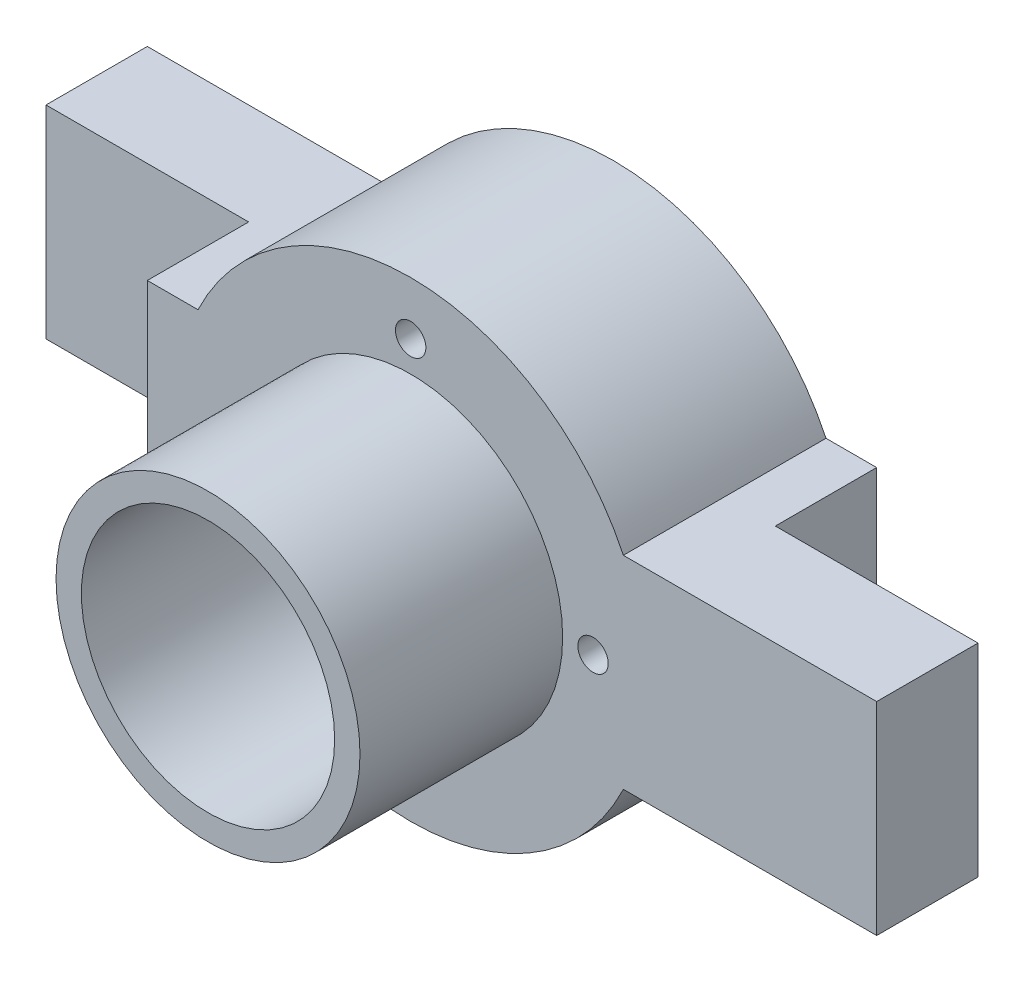
from build123d import *

# Parameters (mm, degrees)
CROQUIS1_R              = 15
CROQUIS1_R_2            = 12.5
SALIENTE_EXTRUIR1_DEPTH = 20
CROQUIS8_R              = 23.25
CROQUIS8_R_2            = 1.5
SALIENTE_EXTRUIR2_DEPTH = 20
CROQUIS10_W             = 25
CROQUIS10_H             = 20
SALIENTE_EXTRUIR6_DEPTH = 20
CROQUIS11_W             = 20
CROQUIS11_H             = 20
CORTAR_EXTRUIR2_DEPTH   = 10
CROQUIS12_W             = 20
CROQUIS12_H             = 20
CORTAR_EXTRUIR3_DEPTH   = 10


with BuildPart() as part:
    # Croquis1 → Saliente-Extruir1 (new body)
    with BuildSketch(Plane.XY):
        Circle(CROQUIS1_R)
        Circle(CROQUIS1_R_2, mode=Mode.SUBTRACT)
    extrude(amount=-SALIENTE_EXTRUIR1_DEPTH)

    # Croquis8 → Saliente-Extruir2 (add)
    with BuildSketch(Plane(origin=(0, 0, -20), x_dir=(-1, 0, 0), z_dir=(0, 0, -1))):
        Circle(CROQUIS8_R)
        with Locations((0, 18)):
            Circle(CROQUIS8_R_2, mode=Mode.SUBTRACT)
        with Locations((18, 0)):
            Circle(CROQUIS8_R_2, mode=Mode.SUBTRACT)
        with Locations((0, -18)):
            Circle(CROQUIS8_R_2, mode=Mode.SUBTRACT)
        with Locations((-18, 0)):
            Circle(CROQUIS8_R_2, mode=Mode.SUBTRACT)
    extrude(amount=SALIENTE_EXTRUIR2_DEPTH)

    # Croquis10 → Saliente-Extruir6 (add)
    with BuildSketch(Plane(origin=(0, 0, -40), x_dir=(-1, 0, 0), z_dir=(0, 0, -1))):
        with Locations((-33.489580749, 0)):
            Rectangle(CROQUIS10_W, CROQUIS10_H)
        with Locations((33.489580749, 0)):
            Rectangle(CROQUIS10_W, CROQUIS10_H)
    extrude(amount=-SALIENTE_EXTRUIR6_DEPTH)

    # Croquis11 → Cortar-Extruir2 (cut)
    with BuildSketch(Plane(origin=(0, 0, -20), x_dir=(-1, 0, 0), z_dir=(0, 0, -1))):
        with Locations((35.989580749, 0)):
            Rectangle(CROQUIS11_W, CROQUIS11_H)
    extrude(amount=CORTAR_EXTRUIR2_DEPTH, mode=Mode.SUBTRACT)

    # Croquis12 → Cortar-Extruir3 (cut)
    with BuildSketch(Plane.XY.offset(-40)):
        with Locations((35.989580749, 0)):
            Rectangle(CROQUIS12_W, CROQUIS12_H)
    extrude(amount=CORTAR_EXTRUIR3_DEPTH, mode=Mode.SUBTRACT)


solid = part.part
